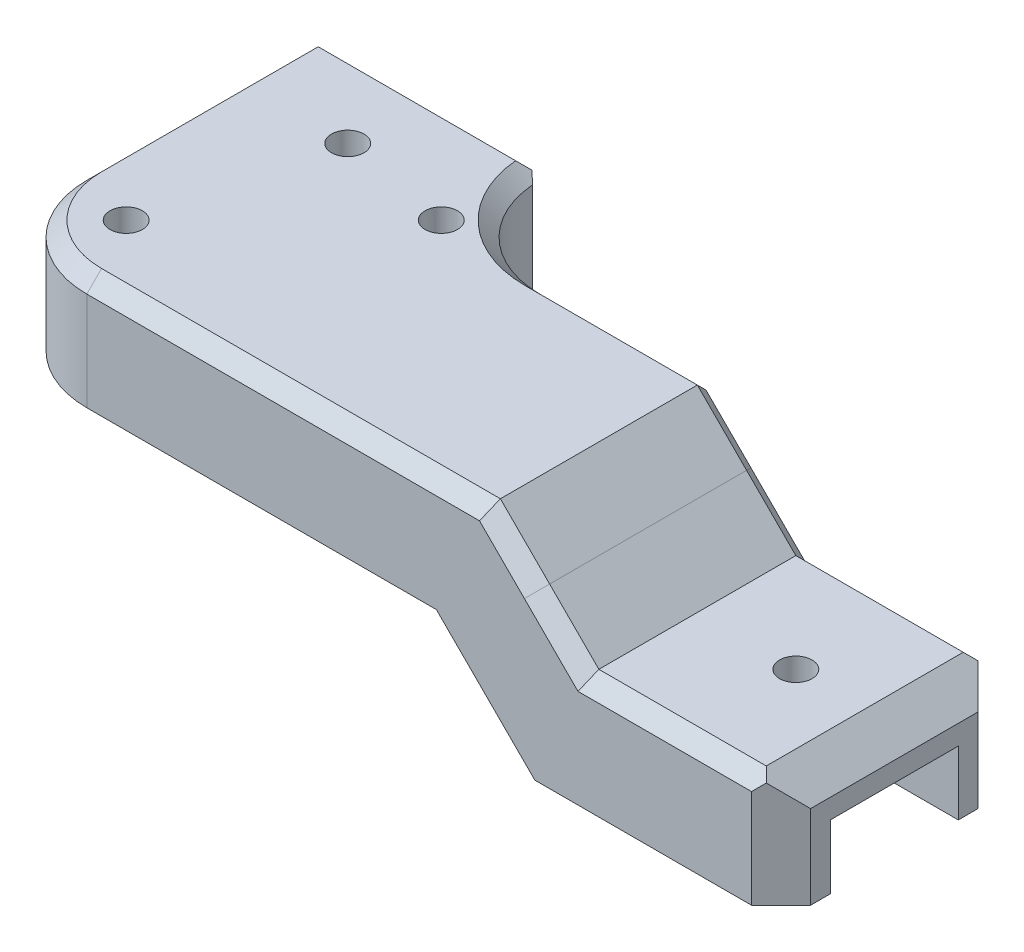
from build123d import *

# Parameters (mm, degrees)
SKETCH_1_W          = 23
SKETCH_1_H          = 23
SKETCH_1_W_2        = 13
SKETCH_1_H_2        = 13
EXTRUDE_1_DEPTH     = 35
SKETCH_2_R          = 1.65
CUT_EXTRUDE_1_DEPTH = 34
SKETCH_4_W          = 23
SKETCH_4_H          = 23
SKETCH_4_R          = 3
EXTRUDE_2_DEPTH     = 3.5
SKETCH_5_W          = 23
SKETCH_5_H          = 23
SKETCH_5_W_2        = 13
SKETCH_5_H_2        = 13
EXTRUDE_1_2_DEPTH   = 54
SKETCH_6_R          = 1.65
CUT_EXTRUDE_2_DEPTH = 39
SKETCH_7_W          = 13
SKETCH_7_H          = 13
CUT_EXTRUDE_3_DEPTH = 13
CHAMFER_1_SIZE      = 3
SKETCH_8_W          = 80.5
SKETCH_8_H          = 35
CUT_EXTRUDE_4_DEPTH = 11.5
EXTRUDE_3_DEPTH     = 6.5
FILLET_1_R          = 10
FILLET_2_R          = 10
SKETCH_10_R         = 1.65
CUT_EXTRUDE_5_DEPTH = 28.5
CHAMFER_4_SIZE      = 3
CHAMFER_START       = 6.5
CHAMFER_5_DEPTH     = 11.5
SKETCH_11_W         = 10
SKETCH_11_H         = 13
EXTRUDE_4_DEPTH     = 10
CHAMFER_9_SIZE      = 5
CHAMFER_10_SIZE     = 5
CHAMFER_11_SIZE     = 10
CHAMFER_12_SIZE     = 10
CHAMFER_13_SIZE     = 1.5
CHAMFER_14_SIZE     = 1.5
SKETCH_12_W         = 99.580162389
SKETCH_12_H         = 41.70081518
CUT_EXTRUDE_6_DEPTH = 35


with BuildPart() as part:
    # 草图1 → Extrude 1 (new body)
    with BuildSketch(Plane.XY):
        with Locations((6.5, 6.5)):
            Rectangle(SKETCH_1_W, SKETCH_1_H)
        with Locations((6.5, 6.5)):
            Rectangle(SKETCH_1_W_2, SKETCH_1_H_2, mode=Mode.SUBTRACT)
    extrude(amount=EXTRUDE_1_DEPTH)

    # 草图2 → 切除-拉伸1 (cut)
    with BuildSketch(Plane.XZ.offset(5)):
        with Locations(Location((6.5, 25, 0), (0, 0, 270))):
            Circle(SKETCH_2_R)
    extrude(amount=-CUT_EXTRUDE_1_DEPTH, mode=Mode.SUBTRACT)

    # 草图4 → 凸台-拉伸2 (add)
    with BuildSketch(Plane(origin=(18, 0, 0), x_dir=(0, 0, -1), z_dir=(1, 0, 0))):
        with Locations((-11.5, 6.5)):
            Rectangle(SKETCH_4_W, SKETCH_4_H)
        with Locations(Location((-11.5, 6.5, 0), (0, 0, 90))):
            Circle(SKETCH_4_R, mode=Mode.SUBTRACT)
    extrude(amount=EXTRUDE_2_DEPTH)

    # 草图5 → Extrude 1 2 (add)
    with BuildSketch(Plane(origin=(21.5, 0, 0), x_dir=(0, 0, -1), z_dir=(1, 0, 0))):
        with Locations((-11.5, 6.5)):
            Rectangle(SKETCH_5_W, SKETCH_5_H)
        with Locations((-11.5, 6.5)):
            Rectangle(SKETCH_5_W_2, SKETCH_5_H_2, mode=Mode.SUBTRACT)
    extrude(amount=EXTRUDE_1_2_DEPTH)

    # 草图6 → 切除-拉伸2 (cut)
    with BuildSketch(Plane(origin=(0, 18, 0), x_dir=(1, 0, 0), z_dir=(0, 1, 0))):
        with Locations(Location((65.5, -11.5, 0), (0, 0, 270))):
            Circle(SKETCH_6_R)
    extrude(amount=-CUT_EXTRUDE_2_DEPTH, mode=Mode.SUBTRACT)

    # 草图7 → 切除-拉伸3 (cut)
    with BuildSketch(Plane(origin=(21.5, 0, 0), x_dir=(0, 0, -1), z_dir=(1, 0, 0))):
        with Locations((-11.5, 6.5)):
            Rectangle(SKETCH_7_W, SKETCH_7_H)
    extrude(amount=-CUT_EXTRUDE_3_DEPTH, mode=Mode.SUBTRACT)

    # 倒角1
    chamfer_1_edges = [part.edges().sort_by_distance(p)[0] for p in [
        (13, 6.5, 18),
    ]]
    chamfer(chamfer_1_edges, length=CHAMFER_1_SIZE)

    # 草图8 → 切除-拉伸4 (cut)
    with BuildSketch(Plane.XZ.offset(5)):
        with Locations((35.25, 17.5)):
            Rectangle(SKETCH_8_W, SKETCH_8_H)
    extrude(amount=-CUT_EXTRUDE_4_DEPTH, mode=Mode.SUBTRACT)

    # 草图9 → 凸台-拉伸3 (add)
    with BuildSketch(Plane.XZ.offset(-13)):
        Polygon((13, 5), (0, 16), (0, 0), (13, 0), align=None)
    extrude(amount=EXTRUDE_3_DEPTH)

    # 圆角1
    fillet_1_edges = [part.edges().sort_by_distance(p)[0] for p in [
        (-5, 12.25, 0),
    ]]
    fillet(fillet_1_edges, radius=FILLET_1_R)

    # 圆角2
    fillet_2_edges = [part.edges().sort_by_distance(p)[0] for p in [
        (18, 12.25, 23),
    ]]
    fillet(fillet_2_edges, radius=FILLET_2_R)

    # 草图10 → 切除-拉伸5 (cut)
    with BuildSketch(Plane.XZ.offset(-6.5)):
        with Locations(Location((2, 7, 0), (0, 0, 270))):
            Circle(SKETCH_10_R)
        with Locations(Location((18, 23, 0), (0, 0, 270))):
            Circle(SKETCH_10_R)
    extrude(amount=-CUT_EXTRUDE_5_DEPTH, mode=Mode.SUBTRACT)

    # 倒角4
    chamfer_4_edges = [part.edges().sort_by_distance(p)[0] for p in [
        (75.5, 18, 11.5),
        (6.5, 18, 35),
    ]]
    chamfer(chamfer_4_edges, length=CHAMFER_4_SIZE)

    # 倒角5: read off the stored shape, not the designer's step
    # 倒角5 outline → 倒角5 (cut)
    with BuildSketch(Plane(origin=(0, 0, 0), x_dir=(1, 0, 0), z_dir=(0, 1, 0)).offset(CHAMFER_START)):
        Polygon((72.5, 0), (75.5, -3), (75.5, 0), align=None)
        Polygon((-5, -35), (-2, -35), (-5, -32), align=None)
        with BuildLine():
            ThreePointArc((18, -33), (18.007410169, -32.615099398), (18.029629695, -32.230769231))
            Line((18.029629695, -32.230769231), (15.038518603, -35))
            Line((15.038518603, -35), (18, -35))
            Line((18, -35), (18, -33))
        make_face()
        Polygon((75.5, -20), (72.5, -23), (75.5, -23), align=None)
    extrude(amount=CHAMFER_5_DEPTH, mode=Mode.SUBTRACT)


with BuildPart() as body_2:
    # Split Bodies 1: the piece on the far side of the plane
    add(part.part)
    split(bisect_by=Plane.YZ.offset(50.5), keep=Keep.BOTTOM)


with BuildPart() as part_1:
    add(part.part)

    # Split Bodies 1
    split(bisect_by=Plane.YZ.offset(50.5), keep=Keep.TOP)


with BuildPart() as part_2:
    # Move Body 1: read off the stored shape, not the designer's step
    # Move Body 1: moved
    add(part_1.part.moved(Location((0, -10, 0))))

    # Combine 1: union body 2
    add(body_2.part)

    # 草图11 → 凸台-拉伸4 (add)
    with BuildSketch(Plane.XZ.offset(-13)):
        with Locations((45.5, 11.5)):
            Rectangle(SKETCH_11_W, SKETCH_11_H)
    extrude(amount=EXTRUDE_4_DEPTH)

    # 倒角9
    chamfer_9_edges = [part_2.edges().sort_by_distance(p)[0] for p in [
        (50.5, 18, 11.5),
    ]]
    chamfer(chamfer_9_edges, length=CHAMFER_9_SIZE)

    # 倒角10
    chamfer_10_edges = [part_2.edges().sort_by_distance(p)[0] for p in [
        (50.5, 8, 11.5),
    ]]
    chamfer(chamfer_10_edges, length=CHAMFER_10_SIZE - 0.0001)  # a hair under: the kernel refuses the full size

    # 倒角11
    # the kernel refuses this chamfer: 10 mm, written as the material it adds along each edge
    with BuildSketch(Plane(origin=(50.5, 6.5, 30.71682988), x_dir=(-1, 0, 0), z_dir=(0, 0, -1))) as chamfer_11_piece_1_section:
        Polygon((CHAMFER_11_SIZE, 0), (0, -CHAMFER_11_SIZE), (0, 0), align=None)
    chamfer_11_piece_1 = extrude(amount=30.71682988, mode=Mode.PRIVATE)
    chamfer_11_piece_1 = split(chamfer_11_piece_1, bisect_by=Plane(origin=(50.5, -3.5, 30.71682988), z_dir=(0, 1, 0)), keep=Keep.TOP, mode=Mode.PRIVATE)
    chamfer_11_piece_1 = split(chamfer_11_piece_1, bisect_by=Plane(origin=(50.5, 6.5, 23), z_dir=(0, 0, -1)), keep=Keep.TOP, mode=Mode.PRIVATE)
    chamfer_11_piece_1 = split(chamfer_11_piece_1, bisect_by=Plane(origin=(50.5, 6.5, 18), z_dir=(0, 0, 1)), keep=Keep.TOP, mode=Mode.PRIVATE)
    add(chamfer_11_piece_1)
    with BuildSketch(Plane(origin=(50.5, 6.5, 5), x_dir=(-1, 0, 0), z_dir=(0, 0, -1))) as chamfer_11_piece_2_section:
        Polygon((CHAMFER_11_SIZE, 0), (0, -CHAMFER_11_SIZE), (0, 0), align=None)
    chamfer_11_piece_2 = extrude(amount=5, mode=Mode.PRIVATE)
    chamfer_11_piece_2 = split(chamfer_11_piece_2, bisect_by=Plane(origin=(50.5, -3.5, 5), z_dir=(0, 1, 0)), keep=Keep.TOP, mode=Mode.PRIVATE)
    add(chamfer_11_piece_2)
    with BuildSketch(Plane(origin=(50.5, 6.5, 23), x_dir=(-1, 0, 0), z_dir=(0, 0, -1))) as chamfer_11_piece_3_section:
        Polygon((CHAMFER_11_SIZE, 0), (0, -CHAMFER_11_SIZE), (0, 0), align=None)
    chamfer_11_piece_3 = extrude(amount=5, mode=Mode.PRIVATE)
    chamfer_11_piece_3 = split(chamfer_11_piece_3, bisect_by=Plane(origin=(50.5, -3.5, 23), z_dir=(0, 1, 0)), keep=Keep.TOP, mode=Mode.PRIVATE)
    add(chamfer_11_piece_3)
    with BuildSketch(Plane(origin=(50.5, 6.5, 23), x_dir=(-1, 0, 0), z_dir=(0, 0, -1))) as chamfer_11_piece_4_section:
        Polygon((CHAMFER_11_SIZE, 0), (0, -CHAMFER_11_SIZE), (0, 0), align=None)
    chamfer_11_piece_4 = extrude(amount=30.71682988, mode=Mode.PRIVATE)
    chamfer_11_piece_4 = split(chamfer_11_piece_4, bisect_by=Plane(origin=(50.5, 6.5, 0), z_dir=(0, 0, 1)), keep=Keep.TOP, mode=Mode.PRIVATE)
    chamfer_11_piece_4 = split(chamfer_11_piece_4, bisect_by=Plane(origin=(50.5, -3.5, 23), z_dir=(0, 1, 0)), keep=Keep.TOP, mode=Mode.PRIVATE)
    chamfer_11_piece_4 = split(chamfer_11_piece_4, bisect_by=Plane(origin=(50.5, 6.5, 5), z_dir=(0, 0, -1)), keep=Keep.TOP, mode=Mode.PRIVATE)
    add(chamfer_11_piece_4)

    # 倒角12
    # the kernel refuses this chamfer: 10 mm, written as the material it takes off along each edge
    with BuildSketch(Plane(origin=(40.5, 3, 5), x_dir=(1, 0, 0), z_dir=(0, 0, 1))) as chamfer_12_piece_1:
        Polygon((CHAMFER_12_SIZE, 0), (0, CHAMFER_12_SIZE), (0, 0), align=None)
    extrude(amount=13, mode=Mode.SUBTRACT)

    # 倒角13
    chamfer_13_edges = [part_2.edges().sort_by_distance(p)[0] for p in [
        (-5, 18, 21),
        (-2.071067812, 18, 2.928932188),
        (25.25, 18, 0),
        (21.291796068, 18, 25.583801513),
        (36.75, 18, 23),
    ]]
    chamfer(chamfer_13_edges, length=CHAMFER_13_SIZE)

    # 倒角14
    chamfer_14_edges = [part_2.edges().sort_by_distance(p)[0] for p in [
        (48.75, 14.75, 0),
        (50.5, 12.99995, 0),
        (52.99995, 10.49995, 0),
        (63.99995, 8, 0),
        (48.75, 14.75, 23),
        (50.5, 12.99995, 23),
        (52.99995, 10.49995, 23),
        (63.99995, 8, 23),
    ]]
    chamfer(chamfer_14_edges, length=CHAMFER_14_SIZE)

    # 镜向1: part across face


with BuildPart() as part_3:
    add(part_2.part)
    add(part_2.part.mirror(Plane(origin=(39.29455316, 7.74366918, 0), x_dir=(1, 0, 0), z_dir=(0, 0, -1))))

    # 草图12 → 切除-拉伸6 (cut)
    with BuildSketch(Plane.XY.offset(35)):
        with Locations((40.094907988, 6.821209465)):
            Rectangle(SKETCH_12_W, SKETCH_12_H)
    extrude(amount=-CUT_EXTRUDE_6_DEPTH, mode=Mode.SUBTRACT)


solid = part_3.part
